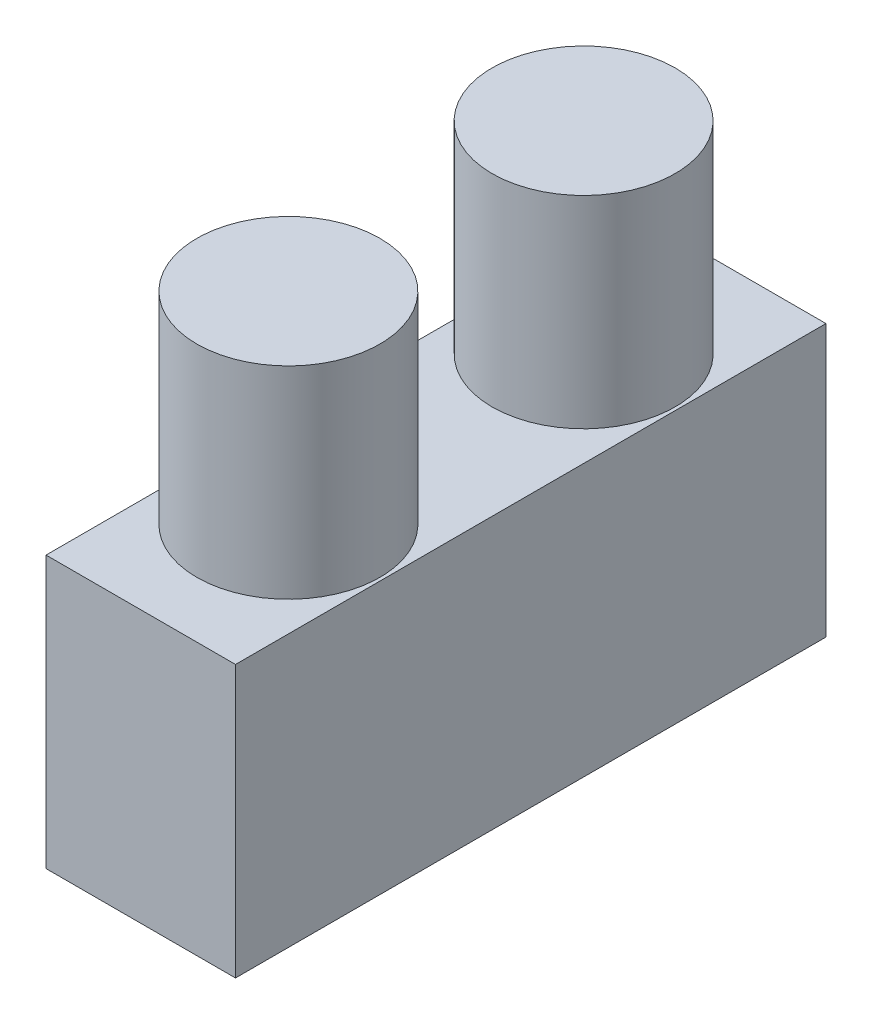
from build123d import *

# Parameters (mm, degrees)
SKETCH1_W           = 6
SKETCH1_H           = 18.7
BOSS_EXTRUDE1_DEPTH = 8.6
SKETCH2_R           = 2.9
BOSS_EXTRUDE2_DEPTH = 6.4


with BuildPart() as part:
    # Sketch1 → Boss-Extrude1 (new body)
    with BuildSketch(Plane(origin=(0, 0, 0), x_dir=(1, 0, 0), z_dir=(0, 1, 0))):
        with Locations((3, 9.35)):
            Rectangle(SKETCH1_W, SKETCH1_H)
    extrude(amount=BOSS_EXTRUDE1_DEPTH)

    # Sketch2 → Boss-Extrude2 (add)
    with BuildSketch(Plane(origin=(0, 8.6, 0), x_dir=(1, 0, 0), z_dir=(0, 1, 0))):
        with Locations((3, 14.025)):
            Circle(SKETCH2_R)
        with Locations((3, 4.675)):
            Circle(SKETCH2_R)
    extrude(amount=BOSS_EXTRUDE2_DEPTH)


solid = part.part
